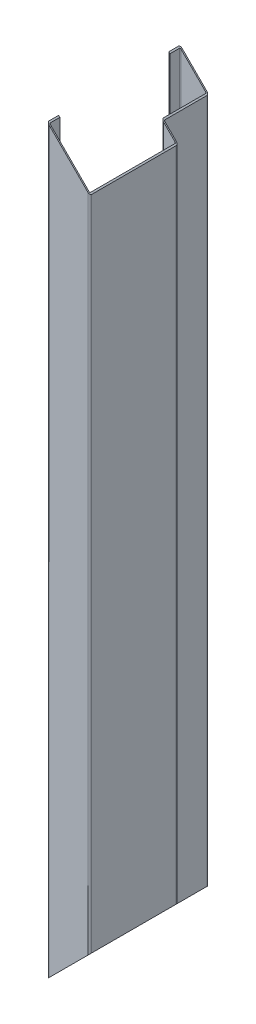
from build123d import *

# Parameters (mm, degrees)
BASE_FLANGE1_DEPTH = 390.5
CUT_EXTRUDE2_DEPTH = 419.369827425


# Sheet-metal steps are written as plain solids
with BuildPart() as part:
    # Sketch1 → Base-Flange1 (new, symmetric)
    with BuildSketch(Plane(origin=(0, 0, 0), x_dir=(1, 0, 0), z_dir=(0, 1, 0))):
        with BuildLine():
            Line((9.5, 58), (9.5, 68.0134))
            ThreePointArc((9.5, 68.0134), (10.081861668, 69.418138332), (11.4866, 70))
            Line((11.4866, 70), (37.5134, 70))
            ThreePointArc((37.5134, 70), (38.918138332, 69.418138332), (39.5, 68.0134))
            Line((39.5, 68.0134), (39.5, 23.7366))
            ThreePointArc((39.5, 23.7366), (39.715745145, 23.215745145), (40.2366, 23))
            Line((40.2366, 23), (52.2634, 23))
            ThreePointArc((52.2634, 23), (53.668138332, 22.418138332), (54.25, 21.0134))
            Line((54.25, 21.0134), (54.25, 18))
            Line((54.25, 18), (54.25, -23))
            Line((54.25, -23), (54.25, -68.0134))
            ThreePointArc((54.25, -68.0134), (53.668138332, -69.418138332), (52.2634, -70))
            Line((52.2634, -70), (39.5, -70))
            Line((39.5, -70), (11.4866, -70))
            ThreePointArc((11.4866, -70), (10.081861668, -69.418138332), (9.5, -68.0134))
            Line((9.5, -68.0134), (9.5, -58))
            Line((9.5, -58), (10.75, -58))
            Line((10.75, -58), (10.75, -68.0134))
            ThreePointArc((10.75, -68.0134), (10.965745145, -68.534254855), (11.4866, -68.75))
            Line((11.4866, -68.75), (39.5, -68.75))
            Line((39.5, -68.75), (52.2634, -68.75))
            ThreePointArc((52.2634, -68.75), (52.784254855, -68.534254855), (53, -68.0134))
            Line((53, -68.0134), (53, -23))
            Line((53, -23), (53, 18))
            Line((53, 18), (53, 21.0134))
            ThreePointArc((53, 21.0134), (52.784254855, 21.534254855), (52.2634, 21.75))
            Line((52.2634, 21.75), (40.2366, 21.75))
            ThreePointArc((40.2366, 21.75), (38.831861668, 22.331861668), (38.25, 23.7366))
            Line((38.25, 23.7366), (38.25, 68.0134))
            ThreePointArc((38.25, 68.0134), (38.034254855, 68.534254855), (37.5134, 68.75))
            Line((37.5134, 68.75), (11.4866, 68.75))
            ThreePointArc((11.4866, 68.75), (10.965745145, 68.534254855), (10.75, 68.0134))
            Line((10.75, 68.0134), (10.75, 58))
            Line((10.75, 58), (9.5, 58))
        make_face()
    extrude(amount=BASE_FLANGE1_DEPTH, both=True)

    # Sketch2 → Cut-Extrude2 (cut, through all)
    with BuildSketch(Plane.XY.offset(70)):
        Polygon((9.5, -390.5), (204.29871247, -195.70128753), (123.087268974, -390.5), align=None)
        Polygon((123.087268974, 390.5), (9.5, 390.5), (204.29871247, 195.70128753), align=None)
    extrude(amount=-CUT_EXTRUDE2_DEPTH, mode=Mode.SUBTRACT)


solid = part.part
